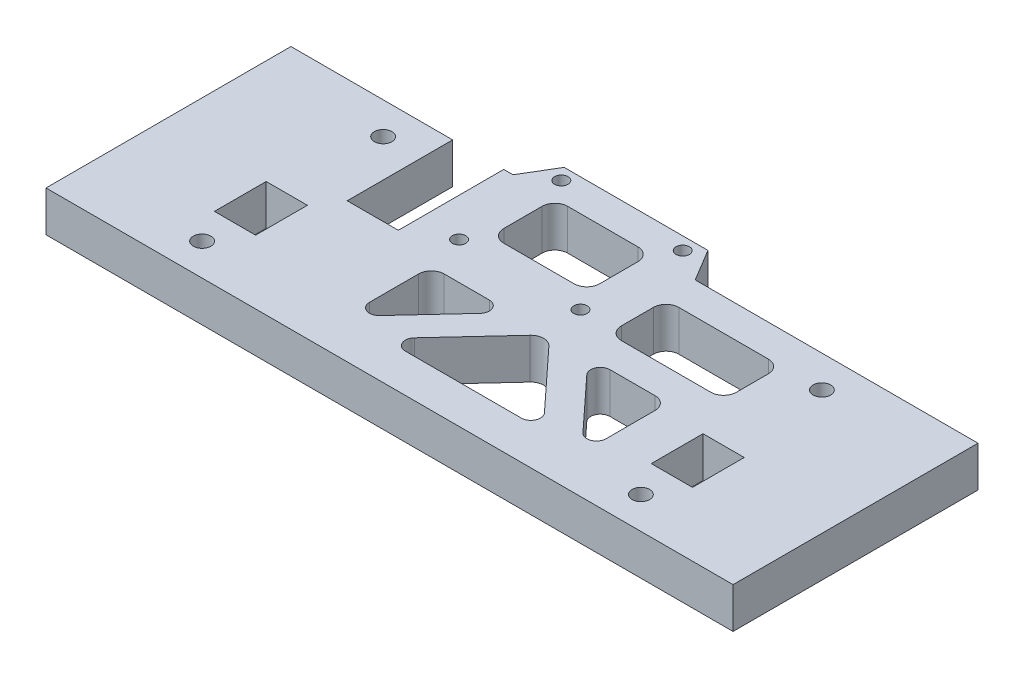
from build123d import *

# Parameters (mm, degrees)
SKETCH1_R           = 2.75
SKETCH1_W           = 12.9
SKETCH1_H           = 16.2
BOSS_EXTRUDE1_DEPTH = 12.7
SKETCH2_W           = 16
SKETCH2_H           = 41.596113018
CUT_EXTRUDE1_DEPTH  = 233.151916856
SKETCH3_R           = 2.1
CUT_EXTRUDE2_DEPTH  = 233.151916856
CUT_EXTRUDE3_DEPTH  = 233.151916856


with BuildPart() as part:
    # Sketch1 → Boss-Extrude1 (new body)
    with BuildSketch(Plane(origin=(0, 0, 0), x_dir=(1, 0, 0), z_dir=(0, 1, 0))):
        Polygon((0, 0), (215, 0), (215, 76.65), (126.5, 76.65), (120.5, 86.65), (75.5, 86.65), (69.5, 76.65), (0, 76.65), align=None)
        with Locations((38.85, 66.65)):
            Circle(SKETCH1_R, mode=Mode.SUBTRACT)
        with Locations((38.85, 10)):
            Circle(SKETCH1_R, mode=Mode.SUBTRACT)
        with Locations((176.15, 66.65)):
            Circle(SKETCH1_R, mode=Mode.SUBTRACT)
        with Locations((176.15, 10)):
            Circle(SKETCH1_R, mode=Mode.SUBTRACT)
        with Locations((39.15, 28.1)):
            Rectangle(SKETCH1_W, SKETCH1_H, mode=Mode.SUBTRACT)
        with Locations((175.85, 28.1)):
            Rectangle(SKETCH1_W, SKETCH1_H, mode=Mode.SUBTRACT)
    extrude(amount=BOSS_EXTRUDE1_DEPTH)

    # Sketch2 → Cut-Extrude1 (cut, through all)
    with BuildSketch(Plane(origin=(0, 12.7, 0), x_dir=(1, 0, 0), z_dir=(0, 1, 0))):
        with Locations((58.6, 64.448056509)):
            Rectangle(SKETCH2_W, SKETCH2_H)
    extrude(amount=-CUT_EXTRUDE1_DEPTH, mode=Mode.SUBTRACT)

    # Sketch3 → Cut-Extrude2 (cut, through all)
    with BuildSketch(Plane(origin=(0, 12.7, 0), x_dir=(1, 0, 0), z_dir=(0, 1, 0))):
        with Locations((78.6, 82.65)):
            Circle(SKETCH3_R)
        with Locations((78.6, 50.65)):
            Circle(SKETCH3_R)
        with Locations((116.6, 82.65)):
            Circle(SKETCH3_R)
        with Locations((116.6, 50.65)):
            Circle(SKETCH3_R)
    extrude(amount=-CUT_EXTRUDE2_DEPTH, mode=Mode.SUBTRACT)

    # Sketch5 → Cut-Extrude3 (cut, through all)
    with BuildSketch(Plane(origin=(0, 12.7, 0), x_dir=(1, 0, 0), z_dir=(0, 1, 0))):
        with BuildLine():
            Line((86.801282022, 17.617384584), (101.93497769, 33.961775906))
            ThreePointArc((101.93497769, 33.961775906), (102.482756625, 37.201109428), (99.733695668, 39))
            Line((99.733695668, 39), (85.6, 39))
            ThreePointArc((85.6, 39), (82.771572875, 37.828427125), (81.6, 35))
            Line((81.6, 35), (81.6, 19.655608678))
            ThreePointArc((81.6, 19.655608678), (83.505432977, 16.862416413), (86.801282022, 17.617384584))
        make_face()
        with BuildLine():
            Line((115.664957304, 35.830153888), (98.26502231, 17.038224094))
            ThreePointArc((98.26502231, 17.038224094), (97.717243375, 13.798890572), (100.466304332, 12))
            Line((100.466304332, 12), (136.733695668, 12))
            ThreePointArc((136.733695668, 12), (139.482756625, 13.798890572), (138.93497769, 17.038224094))
            Line((138.93497769, 17.038224094), (121.535042696, 35.830153888))
            ThreePointArc((121.535042696, 35.830153888), (118.6, 37.112521762), (115.664957304, 35.830153888))
        make_face()
        with BuildLine():
            Line((137.466304332, 39), (151.6, 39))
            ThreePointArc((151.6, 39), (154.428427125, 37.828427125), (155.6, 35))
            Line((155.6, 35), (155.6, 19.655608678))
            ThreePointArc((155.6, 19.655608678), (153.694567023, 16.862416413), (150.398717978, 17.617384584))
            Line((150.398717978, 17.617384584), (135.26502231, 33.961775906))
            ThreePointArc((135.26502231, 33.961775906), (134.717243375, 37.201109428), (137.466304332, 39))
        make_face()
        with BuildLine():
            Line((86.6, 76.65), (108.6, 76.65))
            ThreePointArc((108.6, 76.65), (111.428427125, 75.478427125), (112.6, 72.65))
            Line((112.6, 72.65), (112.6, 60.65))
            ThreePointArc((112.6, 60.65), (111.428427125, 57.821572875), (108.6, 56.65))
            Line((108.6, 56.65), (86.6, 56.65))
            ThreePointArc((86.6, 56.65), (83.771572875, 57.821572875), (82.6, 60.65))
            Line((82.6, 60.65), (82.6, 72.65))
            ThreePointArc((82.6, 72.65), (83.771572875, 75.478427125), (86.6, 76.65))
        make_face()
        with BuildLine():
            Line((131.4, 66.65), (159.4, 66.65))
            ThreePointArc((159.4, 66.65), (162.228427125, 65.478427125), (163.4, 62.65))
            Line((163.4, 62.65), (163.4, 52.65))
            ThreePointArc((163.4, 52.65), (162.228427125, 49.821572875), (159.4, 48.65))
            Line((159.4, 48.65), (131.4, 48.65))
            ThreePointArc((131.4, 48.65), (128.571572875, 49.821572875), (127.4, 52.65))
            Line((127.4, 52.65), (127.4, 62.65))
            ThreePointArc((127.4, 62.65), (128.571572875, 65.478427125), (131.4, 66.65))
        make_face()
    extrude(amount=-CUT_EXTRUDE3_DEPTH, mode=Mode.SUBTRACT)


solid = part.part
